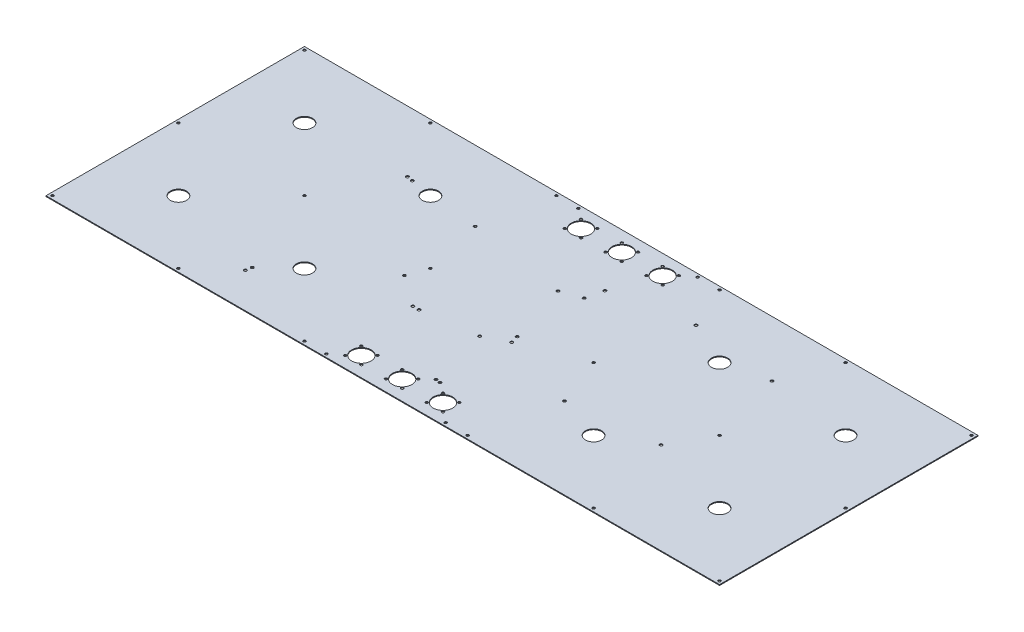
from build123d import *

# Parameters (mm, degrees)
MAIN_PLATE_W        = 834
MAIN_PLATE_H        = 320
BOSS_EXTRUDE1_DEPTH = 1.016
MAIN_HOLES_R        = 1.6
CUT_EXTRUDE1_DEPTH  = 447.64307031
SMA_R               = 10
CUT_EXTRUDE2_DEPTH  = 447.64307031
ADS9_EVAL_2_R       = 1.75
FULL_HOLES_DEPTH    = 448.008036295
FAN_R               = 1.6
FAN_R_2             = 12
CUT_EXTRUDE4_DEPTH  = 448.375011908


with BuildPart() as part:
    # main_plate → Boss-Extrude1 (new body)
    with BuildSketch(Plane(origin=(0, 0, 0), x_dir=(1, 0, 0), z_dir=(0, 1, 0))):
        Rectangle(MAIN_PLATE_W, MAIN_PLATE_H)
    extrude(amount=BOSS_EXTRUDE1_DEPTH)

    # main_holes → Cut-Extrude1 (cut, through all)
    with BuildSketch(Plane(origin=(0, 1.016, 0), x_dir=(1, 0, 0), z_dir=(0, 1, 0))):
        with Locations((-413, 156)):
            Circle(MAIN_HOLES_R)
        with Locations((-257, 156)):
            Circle(MAIN_HOLES_R)
        with Locations((-101, 156)):
            Circle(MAIN_HOLES_R)
        with Locations((-257, 0)):
            Circle(MAIN_HOLES_R)
        with Locations((-101, 0)):
            Circle(MAIN_HOLES_R)
        with Locations((-257, -156)):
            Circle(MAIN_HOLES_R)
        with Locations((-101, -156)):
            Circle(MAIN_HOLES_R)
        with Locations((-413, 0)):
            Circle(MAIN_HOLES_R)
        with Locations((-413, -156)):
            Circle(MAIN_HOLES_R)
        with Locations((413, -156)):
            Circle(MAIN_HOLES_R)
        with Locations((413, 0)):
            Circle(MAIN_HOLES_R)
        with Locations((101, -156)):
            Circle(MAIN_HOLES_R)
        with Locations((257, -156)):
            Circle(MAIN_HOLES_R)
        with Locations((101, 0)):
            Circle(MAIN_HOLES_R)
        with Locations((257, 0)):
            Circle(MAIN_HOLES_R)
        with Locations((101, 156)):
            Circle(MAIN_HOLES_R)
        with Locations((257, 156)):
            Circle(MAIN_HOLES_R)
        with Locations((413, 156)):
            Circle(MAIN_HOLES_R)
        with Locations((-73.81875, 156)):
            Circle(MAIN_HOLES_R)
        with Locations((73.81875, 156)):
            Circle(MAIN_HOLES_R)
        with Locations((73.81875, -156)):
            Circle(MAIN_HOLES_R)
        with Locations((-73.81875, -156)):
            Circle(MAIN_HOLES_R)
    extrude(amount=-CUT_EXTRUDE1_DEPTH, mode=Mode.SUBTRACT)

    # sma → Cut-Extrude2 (cut, through all)
    with BuildSketch(Plane(origin=(0, 1.016, 0), x_dir=(1, 0, 0), z_dir=(0, 1, 0))):
        with Locations((-335, 78)):
            Circle(SMA_R)
        with Locations((-179, 78)):
            Circle(SMA_R)
        with Locations((-179, -78)):
            Circle(SMA_R)
        with Locations((-335, -78)):
            Circle(SMA_R)
        with Locations((335, 78)):
            Circle(SMA_R)
        with Locations((179, 78)):
            Circle(SMA_R)
        with Locations((335, -78)):
            Circle(SMA_R)
        with Locations((179, -78)):
            Circle(SMA_R)
    extrude(amount=-CUT_EXTRUDE2_DEPTH, mode=Mode.SUBTRACT)

    # ads9_eval_2 → full_holes (cut, through all)
    with BuildSketch(Plane(origin=(0, 1.016, 1.016), x_dir=(1, 0, 0), z_dir=(0, 1, 0))):
        with Locations((-213.565632704, 85.178029062)):
            Circle(ADS9_EVAL_2_R)
        with Locations((-206.325632704, 83.858029062)):
            Circle(ADS9_EVAL_2_R)
        with Locations((-212.305632704, -108.301970938)):
            Circle(ADS9_EVAL_2_R)
        with Locations((-213.575632704, -115.481970938)):
            Circle(ADS9_EVAL_2_R)
        with Locations((-71.335632704, -50.391970938)):
            Circle(ADS9_EVAL_2_R)
        with Locations((-63.715632704, -50.391970938)):
            Circle(ADS9_EVAL_2_R)
        with Locations((2.144367296, -41.141970938)):
            Circle(ADS9_EVAL_2_R)
        with Locations((-109.615632704, -22.761970938)):
            Circle(ADS9_EVAL_2_R)
        with Locations((28.534367296, -27.851970938)):
            Circle(ADS9_EVAL_2_R)
        with Locations((25.824367296, -18.381970938)):
            Circle(ADS9_EVAL_2_R)
        with Locations((21.624367296, -114.521970938)):
            Circle(ADS9_EVAL_2_R)
        with Locations((27.266804194, -115.481970938)):
            Circle(ADS9_EVAL_2_R)
        with Locations((2.154367296, 55.888029062)):
            Circle(ADS9_EVAL_2_R)
        with Locations((25.984367296, 64.418029062)):
            Circle(ADS9_EVAL_2_R)
        with Locations((30.904367296, 85.178029062)):
            Circle(ADS9_EVAL_2_R)
        with Locations((-118.315632704, 73.788029062)):
            Circle(ADS9_EVAL_2_R)
        with Locations((124.354014482, 104.524146981)):
            Circle(ADS9_EVAL_2_R)
        with Locations((231.034014482, 91.766913394)):
            Circle(ADS9_EVAL_2_R)
        with Locations((230.960430802, -45.393066868)):
            Circle(ADS9_EVAL_2_R)
        with Locations((124.266804194, -58.035829625)):
            Circle(ADS9_EVAL_2_R)
    extrude(amount=-FULL_HOLES_DEPTH, mode=Mode.SUBTRACT)

    # fan → Cut-Extrude4 (cut, through all)
    with BuildSketch(Plane(origin=(0, 1.016, -2.032), x_dir=(1, 0, 0), z_dir=(0, -1, 0))):
        with Locations((-10, -123.968)):
            Circle(FAN_R)
        with Locations((10, -123.968)):
            Circle(FAN_R)
        with Locations((10, -143.968)):
            Circle(FAN_R)
        with Locations((-10, -143.968)):
            Circle(FAN_R)
        with Locations((0, -133.968)):
            Circle(FAN_R_2)
        with Locations((-60.5, -123.968)):
            Circle(FAN_R)
        with Locations((-40.5, -123.968)):
            Circle(FAN_R)
        with Locations((-40.5, -143.968)):
            Circle(FAN_R)
        with Locations((-60.5, -143.968)):
            Circle(FAN_R)
        with Locations((-50.5, -133.968)):
            Circle(FAN_R_2)
        with Locations((40.5, -123.968)):
            Circle(FAN_R)
        with Locations((60.5, -123.968)):
            Circle(FAN_R)
        with Locations((60.5, -143.968)):
            Circle(FAN_R)
        with Locations((40.5, -143.968)):
            Circle(FAN_R)
        with Locations((50.5, -133.968)):
            Circle(FAN_R_2)
        with Locations((-10, 148.032)):
            Circle(FAN_R)
        with Locations((10, 148.032)):
            Circle(FAN_R)
        with Locations((10, 128.032)):
            Circle(FAN_R)
        with Locations((-10, 128.032)):
            Circle(FAN_R)
        with Locations((0, 138.032)):
            Circle(FAN_R_2)
        with Locations((-60.5, 148.032)):
            Circle(FAN_R)
        with Locations((-40.5, 148.032)):
            Circle(FAN_R)
        with Locations((-40.5, 128.032)):
            Circle(FAN_R)
        with Locations((-60.5, 128.032)):
            Circle(FAN_R)
        with Locations((-50.5, 138.032)):
            Circle(FAN_R_2)
        with Locations((40.5, 148.032)):
            Circle(FAN_R)
        with Locations((60.5, 148.032)):
            Circle(FAN_R)
        with Locations((60.5, 128.032)):
            Circle(FAN_R)
        with Locations((40.5, 128.032)):
            Circle(FAN_R)
        with Locations((50.5, 138.032)):
            Circle(FAN_R_2)
    extrude(amount=CUT_EXTRUDE4_DEPTH, mode=Mode.SUBTRACT)


solid = part.part
